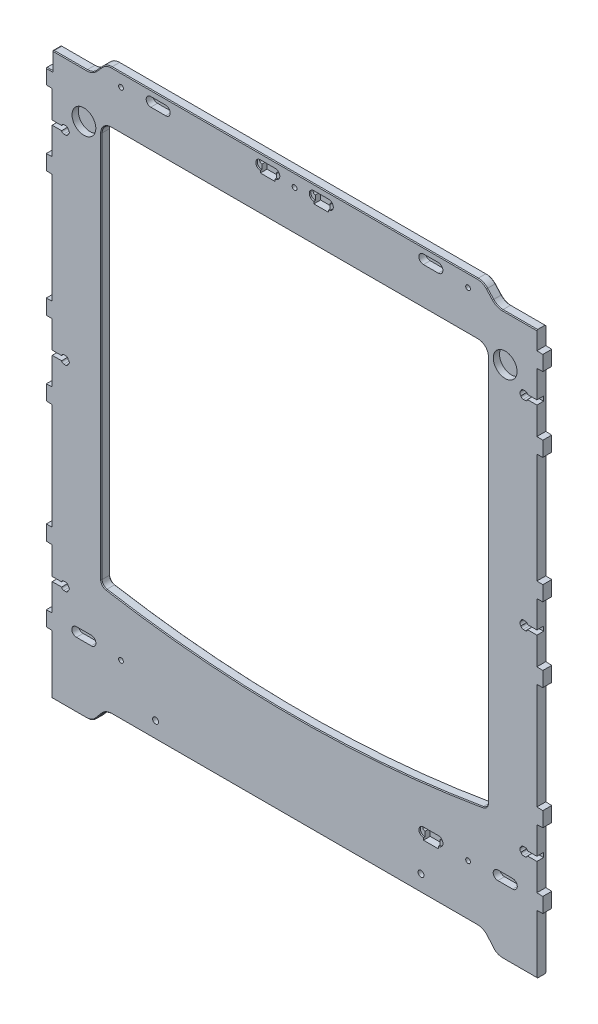
from build123d import *

# Parameters (mm, degrees)
CROQUIS1_W                          = 334.2
CROQUIS1_H                          = 388
SALIENTE_EXTRUIR1_DEPTH             = 6
CORTAR_EXTRUIR1_DEPTH               = 1
CORTAR_EXTRUIR2_DEPTH               = 3.5
CORTAR_EXTRUIR3_DEPTH               = 1
CORTAR_EXTRUIR4_DEPTH               = 3.5
CROQUIS6_W                          = 4
CROQUIS6_H                          = 39.720633844
CORTAR_EXTRUIR5_DEPTH               = 257.114056623
CROQUIS7_W                          = 4
CROQUIS7_H                          = 39.720633844
CORTAR_EXTRUIR6_DEPTH               = 257.114056623
CROQUIS8_W                          = 4
CROQUIS8_H                          = 39.720633844
CORTAR_EXTRUIR7_DEPTH               = 257.114056623
CORTAR_EXTRUIR8_DEPTH               = 4.5
CORTAR_EXTRUIR9_DEPTH               = 4.5
CORTAR_EXTRUIR10_DEPTH              = 4.5
CROQUIS12_W                         = 253.89554102
CROQUIS12_H                         = 10.907202375
CORTAR_EXTRUIR11_DEPTH              = 257.114056623
CROQUIS13_W                         = 4
CROQUIS13_H                         = 22.160316922
CORTAR_EXTRUIR12_DEPTH              = 257.114056623
CROQUIS14_W                         = 36.15222949
CROQUIS14_H                         = 10
CORTAR_EXTRUIR13_DEPTH              = 257.114056623
CROQUIS15_W                         = 40.15222949
CROQUIS15_H                         = 10
CORTAR_EXTRUIR14_DEPTH              = 257.114056623
CROQUIS16_W                         = 4
CROQUIS16_H                         = 12.160316922
CORTAR_EXTRUIR15_DEPTH              = 257.114056623
CROQUIS17_W                         = 4
CROQUIS17_H                         = 73.920633844
CORTAR_EXTRUIR16_DEPTH              = 257.114056623
CROQUIS18_W                         = 4
CROQUIS18_H                         = 71.420633844
CORTAR_EXTRUIR17_DEPTH              = 257.114056623
CROQUIS19_W                         = 4
CROQUIS19_H                         = 39.660316922
CORTAR_EXTRUIR18_DEPTH              = 257.114056623
CORTAR_EXTRUIR23_DEPTH              = 257.114056623
CORTAR_EXTRUIR24_DEPTH              = 4.5
CORTAR_EXTRUIR25_DEPTH              = 4.5
NGULO_DE_SALIDA1_ANGLE              = 2
NGULO_DE_SALIDA2_ANGLE              = 2
NGULO_DE_SALIDA3_ANGLE              = 2
NGULO_DE_SALIDA4_ANGLE              = 2
NGULO_DE_SALIDA5_ANGLE              = 2
NGULO_DE_SALIDA6_ANGLE              = 2
NGULO_DE_SALIDA7_ANGLE              = 2
NGULO_DE_SALIDA8_ANGLE              = 2
NGULO_DE_SALIDA9_ANGLE              = 2
NGULO_DE_SALIDA10_ANGLE             = 2
NGULO_DE_SALIDA11_ANGLE             = 2
NGULO_DE_SALIDA12_ANGLE             = 42.465465587
NGULO_DE_SALIDA13_ANGLE             = 2
NGULO_DE_SALIDA14_ANGLE             = 2
NGULO_DE_SALIDA15_ANGLE             = 2
NGULO_DE_SALIDA16_ANGLE             = 40
DI_METRO_DE_TALADRO_3_2_3_2_1_D     = 3.2
DI_METRO_DE_TALADRO_3_2_3_2_2_D     = 3.2
DI_METRO_DE_TALADRO_3_2_3_2_3_D     = 3.2
DI_METRO_DE_TALADRO_3_2_3_2_3_DEPTH = 4.5
DI_METRO_DE_TALADRO_16_0_16_1_D     = 16
DI_METRO_DE_TALADRO_16_0_16_1_DEPTH = 4.2
DI_METRO_DE_TALADRO_4_0_4_1_D       = 4
DI_METRO_DE_TALADRO_4_0_4_1_DEPTH   = 4.5
REDONDEO1_R                         = 1
REDONDEO3_R                         = 4
REDONDEO4_R                         = 6.5
REDONDEO5_R                         = 8.5
CHAFL_N1_SIZE                       = 0.5


with BuildPart() as part:
    # Croquis1 → Saliente-Extruir1 (new body)
    with BuildSketch(Plane.XY.offset(3)):
        Rectangle(CROQUIS1_W, CROQUIS1_H)
    extrude(amount=-SALIENTE_EXTRUIR1_DEPTH)

    # Croquis2 → Cortar-Extruir1 (cut)
    with BuildSketch(Plane.XY.offset(3)):
        with BuildLine():
            Line((96.8, -151.6), (96.8, -150.1))
            ThreePointArc((96.8, -150.1), (99.9, -147), (96.8, -143.9))
            Line((96.8, -143.9), (86.8, -143.9))
            ThreePointArc((86.8, -143.9), (83.7, -147), (86.8, -150.1))
            Line((86.8, -150.1), (86.8, -151.6))
            Line((86.8, -151.6), (96.8, -151.6))
        make_face()
    extrude(amount=-CORTAR_EXTRUIR1_DEPTH, mode=Mode.SUBTRACT)

    # Croquis3 → Cortar-Extruir2 (cut)
    with BuildSketch(Plane.XY.offset(2)):
        with BuildLine():
            Line((86.8, -146.9), (86.8, -151.6))
            Line((86.8, -151.6), (96.8, -151.6))
            Line((96.8, -151.6), (96.8, -146.9))
            ThreePointArc((96.8, -146.9), (98.3, -145.4), (96.8, -143.9))
            Line((96.8, -143.9), (86.8, -143.9))
            ThreePointArc((86.8, -143.9), (85.3, -145.4), (86.8, -146.9))
        make_face()
    extrude(amount=-CORTAR_EXTRUIR2_DEPTH, mode=Mode.SUBTRACT)

    # Croquis4 → Cortar-Extruir3 (cut)
    with BuildSketch(Plane.XY.offset(3)):
        with BuildLine():
            Line((-13, 182.4), (-13, 183.9))
            ThreePointArc((-13, 183.9), (-9.9, 187), (-13, 190.1))
            Line((-13, 190.1), (-23, 190.1))
            ThreePointArc((-23, 190.1), (-26.1, 187), (-23, 183.9))
            Line((-23, 183.9), (-23, 182.4))
            Line((-23, 182.4), (-13, 182.4))
        make_face()
    cortar_extruir3 = extrude(amount=-CORTAR_EXTRUIR3_DEPTH, mode=Mode.SUBTRACT)

    # Croquis5 → Cortar-Extruir4 (cut)
    with BuildSketch(Plane.XY.offset(2)):
        with BuildLine():
            Line((-23, 187.1), (-23, 182.4))
            Line((-23, 182.4), (-13, 182.4))
            Line((-13, 182.4), (-13, 187.1))
            ThreePointArc((-13, 187.1), (-11.5, 188.6), (-13, 190.1))
            Line((-13, 190.1), (-23, 190.1))
            ThreePointArc((-23, 190.1), (-24.5, 188.6), (-23, 187.1))
        make_face()
    cortar_extruir4 = extrude(amount=-CORTAR_EXTRUIR4_DEPTH, mode=Mode.SUBTRACT)

    # Croquis6 → Cortar-Extruir5 (cut, through all)
    with BuildSketch(Plane(origin=(0, 0, -3), x_dir=(-1, 0, 0), z_dir=(0, 0, -1))):
        with Locations((165.1, 141.7)):
            Rectangle(CROQUIS6_W, CROQUIS6_H)
    cortar_extruir5 = extrude(amount=-CORTAR_EXTRUIR5_DEPTH, mode=Mode.SUBTRACT)

    # Croquis7 → Cortar-Extruir6 (cut, through all)
    with BuildSketch(Plane(origin=(0, 0, -3), x_dir=(-1, 0, 0), z_dir=(0, 0, -1))):
        with Locations((165.1, 7.5)):
            Rectangle(CROQUIS7_W, CROQUIS7_H)
    cortar_extruir6 = extrude(amount=-CORTAR_EXTRUIR6_DEPTH, mode=Mode.SUBTRACT)

    # Croquis8 → Cortar-Extruir7 (cut, through all)
    with BuildSketch(Plane(origin=(0, 0, -3), x_dir=(-1, 0, 0), z_dir=(0, 0, -1))):
        with Locations((165.1, -124.2)):
            Rectangle(CROQUIS8_W, CROQUIS8_H)
    cortar_extruir7 = extrude(amount=-CORTAR_EXTRUIR7_DEPTH, mode=Mode.SUBTRACT)

    # Croquis9 → Cortar-Extruir8 (cut)
    with BuildSketch(Plane.XY.offset(3)):
        with BuildLine():
            Line((-163.1, -125.8), (-156.779019946, -125.8))
            ThreePointArc((-156.779019946, -125.8), (-156.268245837, -126.695643924), (-155.3, -127.05))
            Line((-155.3, -127.05), (-153.9, -127.05))
            ThreePointArc((-153.9, -127.05), (-152.931754163, -126.695643924), (-152.420980054, -125.8))
            Line((-152.420980054, -125.8), (-152.420980054, -125.637509594))
            ThreePointArc((-152.420980054, -125.637509594), (-151.6, -124.3), (-152.420980054, -122.962490406))
            Line((-152.420980054, -122.962490406), (-152.420980054, -122.8))
            ThreePointArc((-152.420980054, -122.8), (-152.931754163, -121.904356076), (-153.9, -121.55))
            Line((-153.9, -121.55), (-155.3, -121.55))
            ThreePointArc((-155.3, -121.55), (-156.268245837, -121.904356076), (-156.779019946, -122.8))
            Line((-156.779019946, -122.8), (-163.1, -122.8))
            Line((-163.1, -122.8), (-163.1, -125.8))
        make_face()
    cortar_extruir8 = extrude(amount=-CORTAR_EXTRUIR8_DEPTH, mode=Mode.SUBTRACT)

    # Croquis10 → Cortar-Extruir9 (cut)
    with BuildSketch(Plane.XY.offset(3)):
        with BuildLine():
            Line((-163.1, 6.1), (-156.779019946, 6.1))
            ThreePointArc((-156.779019946, 6.1), (-156.268245837, 5.204356076), (-155.3, 4.85))
            Line((-155.3, 4.85), (-153.9, 4.85))
            ThreePointArc((-153.9, 4.85), (-152.931754163, 5.204356076), (-152.420980054, 6.1))
            Line((-152.420980054, 6.1), (-152.420980054, 6.262490406))
            ThreePointArc((-152.420980054, 6.262490406), (-151.6, 7.6), (-152.420980054, 8.937509594))
            Line((-152.420980054, 8.937509594), (-152.420980054, 9.1))
            ThreePointArc((-152.420980054, 9.1), (-152.931754163, 9.995643924), (-153.9, 10.35))
            Line((-153.9, 10.35), (-155.3, 10.35))
            ThreePointArc((-155.3, 10.35), (-156.268245837, 9.995643924), (-156.779019946, 9.1))
            Line((-156.779019946, 9.1), (-163.1, 9.1))
            Line((-163.1, 9.1), (-163.1, 6.1))
        make_face()
    cortar_extruir9 = extrude(amount=-CORTAR_EXTRUIR9_DEPTH, mode=Mode.SUBTRACT)

    # Croquis11 → Cortar-Extruir10 (cut)
    with BuildSketch(Plane.XY.offset(3)):
        with BuildLine():
            Line((-163.1, 140.2), (-156.779019946, 140.2))
            ThreePointArc((-156.779019946, 140.2), (-156.268245837, 139.304356076), (-155.3, 138.95))
            Line((-155.3, 138.95), (-153.9, 138.95))
            ThreePointArc((-153.9, 138.95), (-152.931754163, 139.304356076), (-152.420980054, 140.2))
            Line((-152.420980054, 140.2), (-152.420980054, 140.362490406))
            ThreePointArc((-152.420980054, 140.362490406), (-151.6, 141.7), (-152.420980054, 143.037509594))
            Line((-152.420980054, 143.037509594), (-152.420980054, 143.2))
            ThreePointArc((-152.420980054, 143.2), (-152.931754163, 144.095643924), (-153.9, 144.45))
            Line((-153.9, 144.45), (-155.3, 144.45))
            ThreePointArc((-155.3, 144.45), (-156.268245837, 144.095643924), (-156.779019946, 143.2))
            Line((-156.779019946, 143.2), (-163.1, 143.2))
            Line((-163.1, 143.2), (-163.1, 140.2))
        make_face()
    cortar_extruir10 = extrude(amount=-CORTAR_EXTRUIR10_DEPTH, mode=Mode.SUBTRACT)

    # Croquis12 → Cortar-Extruir11 (cut, through all)
    with BuildSketch(Plane(origin=(0, 0, -3), x_dir=(-1, 0, 0), z_dir=(0, 0, -1))):
        with Locations((0, -188.546398813)):
            Rectangle(CROQUIS12_W, CROQUIS12_H)
    extrude(amount=-CORTAR_EXTRUIR11_DEPTH, mode=Mode.SUBTRACT)

    # Croquis13 → Cortar-Extruir12 (cut, through all)
    with BuildSketch(Plane(origin=(0, 0, -3), x_dir=(-1, 0, 0), z_dir=(0, 0, -1))):
        with Locations((-165.1, 182.919841539)):
            Rectangle(CROQUIS13_W, CROQUIS13_H)
    extrude(amount=-CORTAR_EXTRUIR12_DEPTH, mode=Mode.SUBTRACT)

    # Croquis14 → Cortar-Extruir13 (cut, through all)
    with BuildSketch(Plane(origin=(0, 0, -3), x_dir=(-1, 0, 0), z_dir=(0, 0, -1))):
        with Locations((-145.023885255, 189)):
            Rectangle(CROQUIS14_W, CROQUIS14_H)
    extrude(amount=-CORTAR_EXTRUIR13_DEPTH, mode=Mode.SUBTRACT)

    # Croquis15 → Cortar-Extruir14 (cut, through all)
    with BuildSketch(Plane(origin=(0, 0, -3), x_dir=(-1, 0, 0), z_dir=(0, 0, -1))):
        with Locations((147.023885255, 189)):
            Rectangle(CROQUIS15_W, CROQUIS15_H)
    extrude(amount=-CORTAR_EXTRUIR14_DEPTH, mode=Mode.SUBTRACT)

    # Croquis16 → Cortar-Extruir15 (cut, through all)
    with BuildSketch(Plane(origin=(0, 0, -3), x_dir=(-1, 0, 0), z_dir=(0, 0, -1))):
        with Locations((165.1, 177.919841539)):
            Rectangle(CROQUIS16_W, CROQUIS16_H)
    extrude(amount=-CORTAR_EXTRUIR15_DEPTH, mode=Mode.SUBTRACT)

    # Croquis17 → Cortar-Extruir16 (cut, through all)
    with BuildSketch(Plane(origin=(0, 0, -3), x_dir=(-1, 0, 0), z_dir=(0, 0, -1))):
        with Locations((165.1, 74.6)):
            Rectangle(CROQUIS17_W, CROQUIS17_H)
    cortar_extruir16 = extrude(amount=-CORTAR_EXTRUIR16_DEPTH, mode=Mode.SUBTRACT)

    # Croquis18 → Cortar-Extruir17 (cut, through all)
    with BuildSketch(Plane(origin=(0, 0, -3), x_dir=(-1, 0, 0), z_dir=(0, 0, -1))):
        with Locations((165.1, -58.35)):
            Rectangle(CROQUIS18_W, CROQUIS18_H)
    cortar_extruir17 = extrude(amount=-CORTAR_EXTRUIR17_DEPTH, mode=Mode.SUBTRACT)

    # Croquis19 → Cortar-Extruir18 (cut, through all)
    with BuildSketch(Plane(origin=(0, 0, -3), x_dir=(-1, 0, 0), z_dir=(0, 0, -1))):
        with Locations((165.1, -174.169841539)):
            Rectangle(CROQUIS19_W, CROQUIS19_H)
    cortar_extruir18 = extrude(amount=-CORTAR_EXTRUIR18_DEPTH, mode=Mode.SUBTRACT)

    # Croquis24 → Cortar-Extruir23 (cut, through all)
    with BuildSketch(Plane(origin=(0, 0, -3), x_dir=(-1, 0, 0), z_dir=(0, 0, -1))):
        with BuildLine():
            Line((130, 158.5), (-130, 158.5))
            Line((-130, 158.5), (-130, -111.647412505))
            ThreePointArc((-130, -111.647412505), (0, -123), (130, -111.647412505))
            Line((130, -111.647412505), (130, 158.5))
        make_face()
    extrude(amount=-CORTAR_EXTRUIR23_DEPTH, mode=Mode.SUBTRACT)

    # Croquis25 → Cortar-Extruir24 (cut)
    with BuildSketch(Plane.XY.offset(3)):
        with BuildLine():
            Line((-86.75, 190.1), (-96.75, 190.1))
            ThreePointArc((-96.75, 190.1), (-99.85, 187), (-96.75, 183.9))
            Line((-96.75, 183.9), (-86.75, 183.9))
            ThreePointArc((-86.75, 183.9), (-83.65, 187), (-86.75, 190.1))
        make_face()
    cortar_extruir24 = extrude(amount=-CORTAR_EXTRUIR24_DEPTH, mode=Mode.SUBTRACT)

    # Croquis26 → Cortar-Extruir25 (cut)
    with BuildSketch(Plane.XY.offset(3)):
        with BuildLine():
            Line((-146.8, -150.1), (-136.8, -150.1))
            ThreePointArc((-136.8, -150.1), (-133.7, -147), (-136.8, -143.9))
            Line((-136.8, -143.9), (-146.8, -143.9))
            ThreePointArc((-146.8, -143.9), (-149.9, -147), (-146.8, -150.1))
        make_face()
    cortar_extruir25 = extrude(amount=-CORTAR_EXTRUIR25_DEPTH, mode=Mode.SUBTRACT)

    # Simetría1: Cortar-Extruir3, Cortar-Extruir4, Cortar-Extruir5, Cortar-Extruir6, Cortar-Extruir7, Cortar-Extruir8, Cortar-Extruir9, Cortar-Extruir10, Cortar-Extruir16, Cortar-Extruir17, Cortar-Extruir18, Cortar-Extruir24, Cortar-Extruir25 across plane
    add(cortar_extruir3.mirror(Plane(origin=(0, 0, 0), x_dir=(0, 0, 1), z_dir=(1, 0, 0))), mode=Mode.SUBTRACT)
    add(cortar_extruir4.mirror(Plane(origin=(0, 0, 0), x_dir=(0, 0, 1), z_dir=(1, 0, 0))), mode=Mode.SUBTRACT)
    add(cortar_extruir5.mirror(Plane(origin=(0, 0, 0), x_dir=(0, 0, 1), z_dir=(1, 0, 0))), mode=Mode.SUBTRACT)
    add(cortar_extruir6.mirror(Plane(origin=(0, 0, 0), x_dir=(0, 0, 1), z_dir=(1, 0, 0))), mode=Mode.SUBTRACT)
    add(cortar_extruir7.mirror(Plane(origin=(0, 0, 0), x_dir=(0, 0, 1), z_dir=(1, 0, 0))), mode=Mode.SUBTRACT)
    add(cortar_extruir8.mirror(Plane(origin=(0, 0, 0), x_dir=(0, 0, 1), z_dir=(1, 0, 0))), mode=Mode.SUBTRACT)
    add(cortar_extruir9.mirror(Plane(origin=(0, 0, 0), x_dir=(0, 0, 1), z_dir=(1, 0, 0))), mode=Mode.SUBTRACT)
    add(cortar_extruir10.mirror(Plane(origin=(0, 0, 0), x_dir=(0, 0, 1), z_dir=(1, 0, 0))), mode=Mode.SUBTRACT)
    add(cortar_extruir16.mirror(Plane(origin=(0, 0, 0), x_dir=(0, 0, 1), z_dir=(1, 0, 0))), mode=Mode.SUBTRACT)
    add(cortar_extruir17.mirror(Plane(origin=(0, 0, 0), x_dir=(0, 0, 1), z_dir=(1, 0, 0))), mode=Mode.SUBTRACT)
    add(cortar_extruir18.mirror(Plane(origin=(0, 0, 0), x_dir=(0, 0, 1), z_dir=(1, 0, 0))), mode=Mode.SUBTRACT)
    add(cortar_extruir24.mirror(Plane(origin=(0, 0, 0), x_dir=(0, 0, 1), z_dir=(1, 0, 0))), mode=Mode.SUBTRACT)
    add(cortar_extruir25.mirror(Plane(origin=(0, 0, 0), x_dir=(0, 0, 1), z_dir=(1, 0, 0))), mode=Mode.SUBTRACT)

    # Ángulo de salida1
    ngulo_de_salida1_faces = [part.faces().sort_by_distance(p)[0] for p in [
        (165.1, -154.339683078, 0),
    ]]
    draft(ngulo_de_salida1_faces, Plane(origin=(163.1, -154.339683078, 3.000025), x_dir=(0, 0, 1), z_dir=(1, 0, 0)), NGULO_DE_SALIDA1_ANGLE)

    # Ángulo de salida2
    ngulo_de_salida2_faces = [part.faces().sort_by_distance(p)[0] for p in [
        (165.1, 171.839683078, 0),
    ]]
    draft(ngulo_de_salida2_faces, Plane(origin=(163.1, 171.839683078, 3.000025), x_dir=(0, 0, 1), z_dir=(1, 0, 0)), NGULO_DE_SALIDA2_ANGLE)

    # Ángulo de salida3
    ngulo_de_salida3_faces = [part.faces().sort_by_distance(p)[0] for p in [
        (-165.1, 171.839683078, 0),
    ]]
    draft(ngulo_de_salida3_faces, Plane(origin=(-163.1, 184, 3.000025), x_dir=(0, 0, -1), z_dir=(-1, 0, 0)), NGULO_DE_SALIDA3_ANGLE)

    # Ángulo de salida4
    ngulo_de_salida4_faces = [part.faces().sort_by_distance(p)[0] for p in [
        (-165.1, -154.339683078, 0),
    ]]
    draft(ngulo_de_salida4_faces, Plane(origin=(-163.1, -154.339683078, 3.000025), x_dir=(0, 0, -1), z_dir=(-1, 0, 0)), NGULO_DE_SALIDA4_ANGLE)

    # Ángulo de salida5
    ngulo_de_salida5_faces = [part.faces().sort_by_distance(p)[0] for p in [
        (165.1, -22.639683078, 0),
        (165.1, -94.060316922, 0),
    ]]
    draft(ngulo_de_salida5_faces, Plane(origin=(163.1, -22.639683078, 3.000025), x_dir=(0, 0, 1), z_dir=(1, 0, 0)), NGULO_DE_SALIDA5_ANGLE)

    # Ángulo de salida6
    ngulo_de_salida6_faces = [part.faces().sort_by_distance(p)[0] for p in [
        (165.1, 111.560316922, 0),
        (165.1, 37.639683078, 0),
    ]]
    draft(ngulo_de_salida6_faces, Plane(origin=(163.1, 111.560316922, 3.000025), x_dir=(0, 1, 0), z_dir=(1, 0, 0)), NGULO_DE_SALIDA6_ANGLE)

    # Ángulo de salida7
    ngulo_de_salida7_faces = [part.faces().sort_by_distance(p)[0] for p in [
        (-165.1, 37.639683078, 0),
        (-165.1, 111.560316922, 0),
    ]]
    draft(ngulo_de_salida7_faces, Plane(origin=(-163.1, 111.560316922, 3.000025), x_dir=(0, -1, 0), z_dir=(-1, 0, 0)), NGULO_DE_SALIDA7_ANGLE)

    # Ángulo de salida8
    ngulo_de_salida8_faces = [part.faces().sort_by_distance(p)[0] for p in [
        (-165.1, -94.060316922, 0),
        (-165.1, -22.639683078, 0),
    ]]
    draft(ngulo_de_salida8_faces, Plane(origin=(-163.1, -22.639683078, 3.000025), x_dir=(0, 0, -1), z_dir=(-1, 0, 0)), NGULO_DE_SALIDA8_ANGLE)

    # Ángulo de salida9
    ngulo_de_salida9_faces = [part.faces().sort_by_distance(p)[0] for p in [
        (165.1, -104.339683078, 0),
        (165.1, -144.060316922, 0),
    ]]
    draft(ngulo_de_salida9_faces, Plane(origin=(163.1, -104.339683078, 3.000025), x_dir=(0, 1, 0), z_dir=(1, 0, 0)), NGULO_DE_SALIDA9_ANGLE)

    # Ángulo de salida10
    ngulo_de_salida10_faces = [part.faces().sort_by_distance(p)[0] for p in [
        (165.1, -12.360316922, 0),
        (165.1, 27.360316922, 0),
    ]]
    draft(ngulo_de_salida10_faces, Plane(origin=(163.1, 27.360316922, 3.000025), x_dir=(0, 0, 1), z_dir=(1, 0, 0)), NGULO_DE_SALIDA10_ANGLE)

    # Ángulo de salida11
    ngulo_de_salida11_faces = [part.faces().sort_by_distance(p)[0] for p in [
        (165.1, 161.560316922, 0),
        (165.1, 121.839683078, 0),
    ]]
    draft(ngulo_de_salida11_faces, Plane(origin=(163.1, 161.560316922, 3.000025), x_dir=(0, 1, 0), z_dir=(1, 0, 0)), NGULO_DE_SALIDA11_ANGLE)

    # Ángulo de salida12
    ngulo_de_salida12_faces = [part.faces().sort_by_distance(p)[0] for p in [
        (126.94777051, 189, 0),
        (-126.94777051, 189, 0),
    ]]
    draft(ngulo_de_salida12_faces, Plane(origin=(167.1, 194, -3), x_dir=(0, 0, 1), z_dir=(0, 1, 0)), NGULO_DE_SALIDA12_ANGLE)

    # Ángulo de salida13
    ngulo_de_salida13_faces = [part.faces().sort_by_distance(p)[0] for p in [
        (-165.1, 121.839683078, 0),
        (-165.1, 161.560316922, 0),
    ]]
    draft(ngulo_de_salida13_faces, Plane(origin=(-163.1, 161.560316922, 3.000025), x_dir=(0, -1, 0), z_dir=(-1, 0, 0)), NGULO_DE_SALIDA13_ANGLE)

    # Ángulo de salida14
    ngulo_de_salida14_faces = [part.faces().sort_by_distance(p)[0] for p in [
        (-165.1, 27.360316922, 0),
        (-165.1, -12.360316922, 0),
    ]]
    draft(ngulo_de_salida14_faces, Plane(origin=(-163.1, 27.360316922, 3.000025), x_dir=(0, 0, -1), z_dir=(-1, 0, 0)), NGULO_DE_SALIDA14_ANGLE)

    # Ángulo de salida15
    ngulo_de_salida15_faces = [part.faces().sort_by_distance(p)[0] for p in [
        (-165.1, -144.060316922, 0),
        (-165.1, -104.339683078, 0),
    ]]
    draft(ngulo_de_salida15_faces, Plane(origin=(-163.1, -104.339683078, 3.000025), x_dir=(0, -1, 0), z_dir=(-1, 0, 0)), NGULO_DE_SALIDA15_ANGLE)

    # Ángulo de salida16
    ngulo_de_salida16_faces = [part.faces().sort_by_distance(p)[0] for p in [
        (126.94777051, -188.546398812, 0),
        (-126.94777051, -188.546398812, 0),
    ]]
    draft(ngulo_de_salida16_faces, Plane(origin=(-126.94777051, -183.092797625, 3.000025), x_dir=(0, 0, -1), z_dir=(0, -1, 0)), NGULO_DE_SALIDA16_ANGLE)

    # Diámetro de taladro Ø3.2 (3.2)1 (through all)
    with Locations(Plane(origin=(0, 0, -3), x_dir=(-1, 0, 0), z_dir=(0, 0, -1))):
        with Locations((-116.8, -148.55), (-116.8, 185.45)):
            Hole(DI_METRO_DE_TALADRO_3_2_3_2_1_D / 2)

    # Diámetro de taladro Ø3.2 (3.2)2 (through all)
    with Locations(Plane.XY.offset(3)):
        with Locations((-116.8, -148.55), (-116.8, 185.45)):
            Hole(DI_METRO_DE_TALADRO_3_2_3_2_2_D / 2)

    # Diámetro de taladro Ø3.2 (3.2)3
    with Locations(Plane.XY.offset(3)):
        with Locations((0, 185.45)):
            Hole(DI_METRO_DE_TALADRO_3_2_3_2_3_D / 2, depth=DI_METRO_DE_TALADRO_3_2_3_2_3_DEPTH)

    # Diámetro de taladro Ø16.0 (16)1
    with Locations(Plane.XY.offset(3)):
        with Locations((141.75, 153), (-141.75, 153)):
            Hole(DI_METRO_DE_TALADRO_16_0_16_1_D / 2, depth=DI_METRO_DE_TALADRO_16_0_16_1_DEPTH)

    # Diámetro de taladro Ø4.0 (4)1
    with Locations(Plane.XY.offset(3)):
        with Locations((-93.5, -172), (85.1, -172)):
            Hole(DI_METRO_DE_TALADRO_4_0_4_1_D / 2, depth=DI_METRO_DE_TALADRO_4_0_4_1_DEPTH)

    # Redondeo1
    redondeo1_edges = [part.edges().sort_by_distance(p)[0] for p in [
        (-163.1, 184, 0),
    ]]
    fillet(redondeo1_edges, radius=REDONDEO1_R)

    # Redondeo3
    redondeo3_edges = [part.edges().sort_by_distance(p)[0] for p in [
        (-130, -111.647412505, 0),
        (130, -111.647412505, 0),
    ]]
    fillet(redondeo3_edges, radius=REDONDEO3_R)

    # Redondeo4
    redondeo4_edges = [part.edges().sort_by_distance(p)[0] for p in [
        (130, 158.5, 0),
        (-130, 158.5, 0),
    ]]
    fillet(redondeo4_edges, radius=REDONDEO4_R)

    # Redondeo5
    redondeo5_edges = [part.edges().sort_by_distance(p)[0] for p in [
        (126.94777051, -183.092797625, 0),
        (136.1, 184, 0),
        (126.94777051, 194, 0),
        (-136.1, -194, 0),
        (136.1, -194, 0),
        (-136.1, 184, 0),
        (-126.94777051, -183.092797625, 0),
        (-126.94777051, 194, 0),
    ]]
    fillet(redondeo5_edges, radius=REDONDEO5_R)

    # Chaflán1
    chafl_n1_edges = [part.edges().sort_by_distance(p)[0] for p in [
        (151.471573759, 184, -3),
        (136.417456109, 184.720884473, -3),
        (131.523885255, 189, -3),
        (126.6303144, 193.279115527, -3),
        (0, 194, -3),
        (-165.1, 171.769841539, -3),
        (-126.6303144, 193.279115527, -3),
        (-131.523885255, 189, -3),
        (-163.1, 177.419841539, -3),
        (-136.417456109, 184.720884473, -3),
        (-162.807106781, 183.707106781, -3),
        (-150.971573759, 184, -3),
        (151.471573759, 184, 3),
        (136.417456109, 184.720884473, 3),
        (131.523885255, 189, 3),
        (126.6303144, 193.279115527, 3),
        (0, 194, 3),
        (-126.6303144, 193.279115527, 3),
        (-131.523885255, 189, 3),
        (-136.417456109, 184.720884473, 3),
        (-150.971573759, 184, 3),
        (-165.1, 171.769841539, 3),
        (-162.807106781, 183.707106781, 3),
        (-163.1, 177.419841539, 3),
        (-151.581807547, -194, 3),
        (-136.47135987, -193.20361619, 3),
        (-131.523885255, -188.546398812, 3),
        (-126.57641064, -183.889181435, 3),
        (0, -183.092797625, 3),
        (126.57641064, -183.889181435, 3),
        (131.523885255, -188.546398812, 3),
        (136.47135987, -193.20361619, 3),
        (151.581807547, -194, 3),
        (-151.581807547, -194, -3),
        (-136.47135987, -193.20361619, -3),
        (151.581807547, -194, -3),
        (-131.523885255, -188.546398812, -3),
        (136.47135987, -193.20361619, -3),
        (-126.57641064, -183.889181435, -3),
        (131.523885255, -188.546398812, -3),
        (0, -183.092797625, -3),
        (126.57641064, -183.889181435, -3),
        (0, 158.5, 3),
        (128.096194078, 156.596194078, 3),
        (-128.096194078, 156.596194078, 3),
        (130, 21.858870636, 3),
        (-130, 21.858870636, 3),
        (129.057974237, -110.860784191, 3),
        (-129.057974237, -110.860784191, 3),
        (0, -123, 3),
        (128.096194078, 156.596194078, -3),
        (0, 158.5, -3),
        (130, 21.858870636, -3),
        (-128.096194078, 156.596194078, -3),
        (129.057974237, -110.860784191, -3),
        (-130, 21.858870636, -3),
        (0, -123, -3),
        (-129.057974237, -110.860784191, -3),
    ]]
    chamfer(chafl_n1_edges, length=CHAFL_N1_SIZE)


solid = part.part
